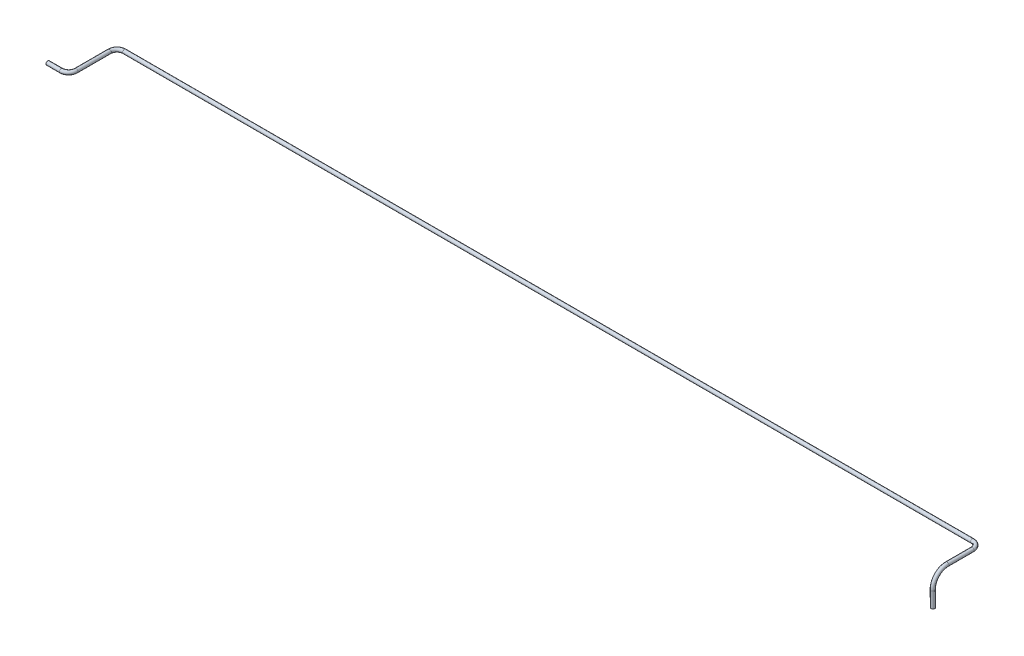
from build123d import *

# Parameters (mm, degrees)
SKETCH5_R   = 3.175
SKETCH5_R_2 = 2.667


with BuildPart() as part:
    # Sweep3: sweep along a curve in space
    with BuildLine() as sweep3_path:
        Line((0, 0, 0), (22.86, 0, 0))
        ThreePointArc((22.86, 0, 0), (31.840256121, 0, -3.719743879), (35.56, 0, -12.7))
        Line((35.56, 0, -12.7), (35.56, 0, -69.85))
        ThreePointArc((35.56, 0, -69.85), (39.279743879, 0, -78.830256121), (48.26, 0, -82.55))
        Line((48.26, 0, -82.55), (1497.880710354, 0, -82.55))
        ThreePointArc((1510.580710354, 0, -69.85), (1506.860966475, 0, -78.830256121), (1497.880710354, 0, -82.55))
        Line((1510.580710354, 0, -69.85), (1510.580710354, 0, -26.738510483))
        ThreePointArc((1510.580710354, 0, -26.738510483), (1510.835819176, -7.278969515, -8.93541517), (1511.45484096, -24.941395583, -1.342379026))
        Line((1511.45484096, -24.941395583, -1.342379026), (1512.359753889, -50.761097073, -0.891417753))
    # Sketch5 → Sweep3 (sweep)
    with BuildSketch(Plane(origin=(0, 0, 0), x_dir=(0, 0, -1), z_dir=(1, 0, 0))):
        Circle(SKETCH5_R)
        Circle(SKETCH5_R_2, mode=Mode.SUBTRACT)
    sweep(path=sweep3_path.line)


solid = part.part
